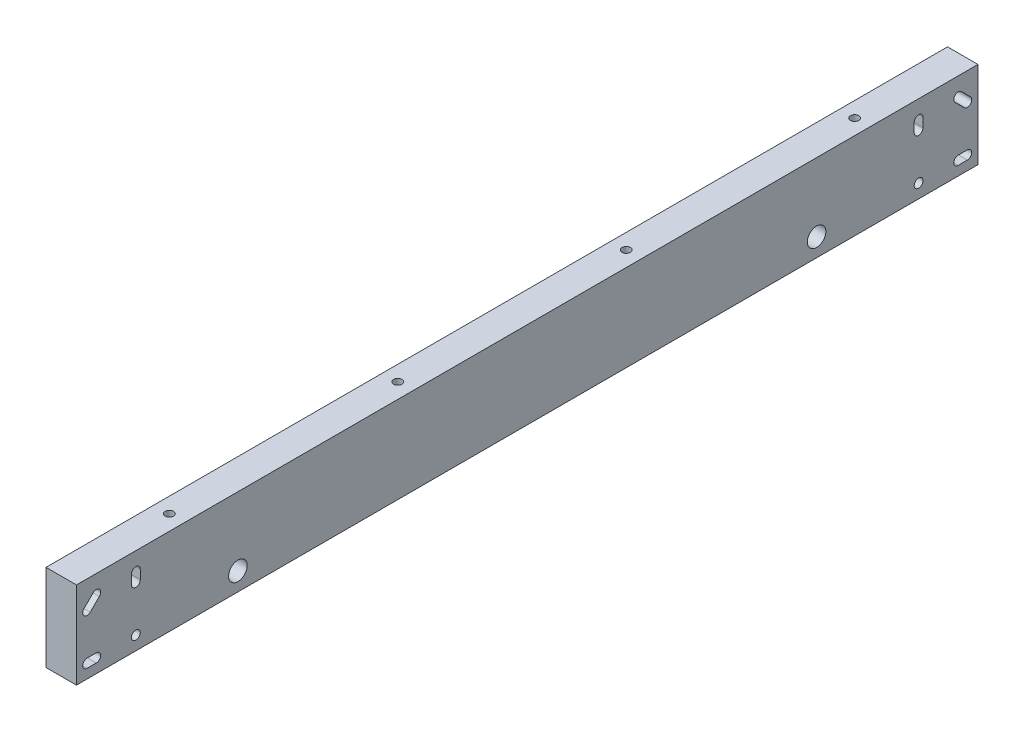
from build123d import *

# Parameters (mm, degrees)
CUT_EXTRUDE1_START       = 5
CUT_EXTRUDE1_OUTLINE_W   = 57
CUT_EXTRUDE1_OUTLINE_H   = 592
CUT_EXTRUDE1_DEPTH       = 5
CUT_EXTRUDE1_START_2     = -10
CUT_EXTRUDE1_2_OUTLINE_W = 57
CUT_EXTRUDE1_2_OUTLINE_H = 592
CUT_EXTRUDE1_2_DEPTH     = 4.9999999
CUT_EXTRUDE1_START_3     = -4.6
CUT_EXTRUDE1_3_DEPTH     = 14.6
CUT_EXTRUDE1_START_4     = -296
CUT_EXTRUDE1_4_OUTLINE_W = 10.0000001
CUT_EXTRUDE1_4_OUTLINE_H = 57
CUT_EXTRUDE1_4_DEPTH     = 592
CUT_EXTRUDE1_START_5     = -73
CUT_EXTRUDE1_5_OUTLINE_R = 5
CUT_EXTRUDE1_5_DEPTH     = 23
CUT_EXTRUDE1_START_6     = -50
CUT_EXTRUDE1_6_OUTLINE_R = 2.75
CUT_EXTRUDE1_6_DEPTH     = 36
CUT_EXTRUDE1_START_7     = -5.0000001
CUT_EXTRUDE1_7_DEPTH     = 10.0000001
CUT_EXTRUDE1_8_DEPTH     = 0.4000001
BOSS_EXTRUDE1_START      = -5.4
BOSS_EXTRUDE1_DEPTH      = 14.6
BOSS_EXTRUDE2_START      = 5.4
BOSS_EXTRUDE2_DEPTH      = 5.4
CUT_EXTRUDE2_DEPTH       = 5.4
CUT_EXTRUDE3_DEPTH       = 306.286750449
SKETCH6_R                = 6.1
CUT_EXTRUDE4_DEPTH       = 306.286750449


with BuildPart() as part:
    # Cut-Extrude1: read off the stored shape, not the designer's step
    # Cut-Extrude1 outline → Cut-Extrude1 (new body)
    with BuildSketch(Plane.YZ.offset(CUT_EXTRUDE1_START)):
        with Locations((-43.5, 0)):
            Rectangle(CUT_EXTRUDE1_OUTLINE_W, CUT_EXTRUDE1_OUTLINE_H)
        with BuildLine():
            Line((-61.5, -285.9), (-64.5, -285.9))
            ThreePointArc((-64.5, -285.9), (-67.4, -283), (-64.5, -280.1))
            Line((-64.5, -280.1), (-61.5, -280.1))
            ThreePointArc((-61.5, -280.1), (-58.6, -283), (-61.5, -285.9))
        make_face(mode=Mode.SUBTRACT)
        with BuildLine():
            Line((-61.5, -259.9), (-64.5, -259.9))
            ThreePointArc((-64.5, -259.9), (-67.4, -257), (-64.5, -254.1))
            Line((-64.5, -254.1), (-61.5, -254.1))
            ThreePointArc((-61.5, -254.1), (-58.6, -257), (-61.5, -259.9))
        make_face(mode=Mode.SUBTRACT)
        with BuildLine():
            Line((-28.5, -280.1), (-25.5, -280.1))
            ThreePointArc((-25.5, -280.1), (-22.6, -283), (-25.5, -285.9))
            Line((-25.5, -285.9), (-28.5, -285.9))
            ThreePointArc((-28.5, -285.9), (-31.4, -283), (-28.5, -280.1))
        make_face(mode=Mode.SUBTRACT)
        with BuildLine():
            Line((-28.5, -254.1), (-25.5, -254.1))
            ThreePointArc((-25.5, -254.1), (-22.6, -257), (-25.5, -259.9))
            Line((-25.5, -259.9), (-28.5, -259.9))
            ThreePointArc((-28.5, -259.9), (-31.4, -257), (-28.5, -254.1))
        make_face(mode=Mode.SUBTRACT)
        with BuildLine():
            Line((-61.5, 254.1), (-64.5, 254.1))
            ThreePointArc((-64.5, 254.1), (-67.4, 257), (-64.5, 259.9))
            Line((-64.5, 259.9), (-61.5, 259.9))
            ThreePointArc((-61.5, 259.9), (-58.6, 257), (-61.5, 254.1))
        make_face(mode=Mode.SUBTRACT)
        with BuildLine():
            Line((-61.5, 280.1), (-64.5, 280.1))
            ThreePointArc((-64.5, 280.1), (-67.4, 283), (-64.5, 285.9))
            Line((-64.5, 285.9), (-61.5, 285.9))
            ThreePointArc((-61.5, 285.9), (-58.6, 283), (-61.5, 280.1))
        make_face(mode=Mode.SUBTRACT)
        with BuildLine():
            Line((-28.5, 259.9), (-25.5, 259.9))
            ThreePointArc((-25.5, 259.9), (-22.6, 257), (-25.5, 254.1))
            Line((-25.5, 254.1), (-28.5, 254.1))
            ThreePointArc((-28.5, 254.1), (-31.4, 257), (-28.5, 259.9))
        make_face(mode=Mode.SUBTRACT)
        with BuildLine():
            Line((-28.5, 285.9), (-25.5, 285.9))
            ThreePointArc((-25.5, 285.9), (-22.6, 283), (-25.5, 280.1))
            Line((-25.5, 280.1), (-28.5, 280.1))
            ThreePointArc((-28.5, 280.1), (-31.4, 283), (-28.5, 285.9))
        make_face(mode=Mode.SUBTRACT)
    extrude(amount=CUT_EXTRUDE1_DEPTH)

    # Cut-Extrude1 3 outline → Cut-Extrude1 3 (add)
    # profile 1 of 8: a face of its own
    with BuildSketch(Plane.YZ.offset(CUT_EXTRUDE1_START_3)):
        with BuildLine():
            Line((-25.5, 288), (-28.5, 288))
            ThreePointArc((-28.5, 288), (-33.5, 283), (-28.5, 278))
            Line((-28.5, 278), (-25.5, 278))
            ThreePointArc((-25.5, 278), (-20.5, 283), (-25.5, 288))
        make_face()
        with BuildLine():
            Line((-28.5, 285.9), (-25.5, 285.9))
            ThreePointArc((-25.5, 285.9), (-22.6, 283), (-25.5, 280.1))
            Line((-25.5, 280.1), (-28.5, 280.1))
            ThreePointArc((-28.5, 280.1), (-31.4, 283), (-28.5, 285.9))
        make_face(mode=Mode.SUBTRACT)
    # profile 2 of 8: a face of its own
    with BuildSketch(Plane.YZ.offset(CUT_EXTRUDE1_START_3)):
        with BuildLine():
            Line((-25.5, 262), (-28.5, 262))
            ThreePointArc((-28.5, 262), (-33.5, 257), (-28.5, 252))
            Line((-28.5, 252), (-25.5, 252))
            ThreePointArc((-25.5, 252), (-20.5, 257), (-25.5, 262))
        make_face()
        with BuildLine():
            Line((-28.5, 259.9), (-25.5, 259.9))
            ThreePointArc((-25.5, 259.9), (-22.6, 257), (-25.5, 254.1))
            Line((-25.5, 254.1), (-28.5, 254.1))
            ThreePointArc((-28.5, 254.1), (-31.4, 257), (-28.5, 259.9))
        make_face(mode=Mode.SUBTRACT)
    # profile 3 of 8: a face of its own
    with BuildSketch(Plane.YZ.offset(CUT_EXTRUDE1_START_3)):
        with BuildLine():
            Line((-64.5, 252), (-61.5, 252))
            ThreePointArc((-61.5, 252), (-56.5, 257), (-61.5, 262))
            Line((-61.5, 262), (-64.5, 262))
            ThreePointArc((-64.5, 262), (-69.5, 257), (-64.5, 252))
        make_face()
        with BuildLine():
            Line((-61.5, 254.1), (-64.5, 254.1))
            ThreePointArc((-64.5, 254.1), (-67.4, 257), (-64.5, 259.9))
            Line((-64.5, 259.9), (-61.5, 259.9))
            ThreePointArc((-61.5, 259.9), (-58.6, 257), (-61.5, 254.1))
        make_face(mode=Mode.SUBTRACT)
    # profile 4 of 8: a face of its own
    with BuildSketch(Plane.YZ.offset(CUT_EXTRUDE1_START_3)):
        with BuildLine():
            Line((-64.5, 278), (-61.5, 278))
            ThreePointArc((-61.5, 278), (-56.5, 283), (-61.5, 288))
            Line((-61.5, 288), (-64.5, 288))
            ThreePointArc((-64.5, 288), (-69.5, 283), (-64.5, 278))
        make_face()
        with BuildLine():
            Line((-61.5, 280.1), (-64.5, 280.1))
            ThreePointArc((-64.5, 280.1), (-67.4, 283), (-64.5, 285.9))
            Line((-64.5, 285.9), (-61.5, 285.9))
            ThreePointArc((-61.5, 285.9), (-58.6, 283), (-61.5, 280.1))
        make_face(mode=Mode.SUBTRACT)
    # profile 5 of 8: a face of its own
    with BuildSketch(Plane.YZ.offset(CUT_EXTRUDE1_START_3)):
        with BuildLine():
            Line((-64.5, -288), (-61.5, -288))
            ThreePointArc((-61.5, -288), (-56.5, -283), (-61.5, -278))
            Line((-61.5, -278), (-64.5, -278))
            ThreePointArc((-64.5, -278), (-69.5, -283), (-64.5, -288))
        make_face()
        with BuildLine():
            Line((-61.5, -285.9), (-64.5, -285.9))
            ThreePointArc((-64.5, -285.9), (-67.4, -283), (-64.5, -280.1))
            Line((-64.5, -280.1), (-61.5, -280.1))
            ThreePointArc((-61.5, -280.1), (-58.6, -283), (-61.5, -285.9))
        make_face(mode=Mode.SUBTRACT)
    # profile 6 of 8: a face of its own
    with BuildSketch(Plane.YZ.offset(CUT_EXTRUDE1_START_3)):
        with BuildLine():
            Line((-64.5, -262), (-61.5, -262))
            ThreePointArc((-61.5, -262), (-56.5, -257), (-61.5, -252))
            Line((-61.5, -252), (-64.5, -252))
            ThreePointArc((-64.5, -252), (-69.5, -257), (-64.5, -262))
        make_face()
        with BuildLine():
            Line((-61.5, -259.9), (-64.5, -259.9))
            ThreePointArc((-64.5, -259.9), (-67.4, -257), (-64.5, -254.1))
            Line((-64.5, -254.1), (-61.5, -254.1))
            ThreePointArc((-61.5, -254.1), (-58.6, -257), (-61.5, -259.9))
        make_face(mode=Mode.SUBTRACT)
    # profile 7 of 8: a face of its own
    with BuildSketch(Plane.YZ.offset(CUT_EXTRUDE1_START_3)):
        with BuildLine():
            Line((-25.5, -252), (-28.5, -252))
            ThreePointArc((-28.5, -252), (-33.5, -257), (-28.5, -262))
            Line((-28.5, -262), (-25.5, -262))
            ThreePointArc((-25.5, -262), (-20.5, -257), (-25.5, -252))
        make_face()
        with BuildLine():
            Line((-28.5, -254.1), (-25.5, -254.1))
            ThreePointArc((-25.5, -254.1), (-22.6, -257), (-25.5, -259.9))
            Line((-25.5, -259.9), (-28.5, -259.9))
            ThreePointArc((-28.5, -259.9), (-31.4, -257), (-28.5, -254.1))
        make_face(mode=Mode.SUBTRACT)
    # profile 8 of 8: a face of its own
    with BuildSketch(Plane.YZ.offset(CUT_EXTRUDE1_START_3)):
        with BuildLine():
            Line((-25.5, -278), (-28.5, -278))
            ThreePointArc((-28.5, -278), (-33.5, -283), (-28.5, -288))
            Line((-28.5, -288), (-25.5, -288))
            ThreePointArc((-25.5, -288), (-20.5, -283), (-25.5, -278))
        make_face()
        with BuildLine():
            Line((-28.5, -280.1), (-25.5, -280.1))
            ThreePointArc((-25.5, -280.1), (-22.6, -283), (-25.5, -285.9))
            Line((-25.5, -285.9), (-28.5, -285.9))
            ThreePointArc((-28.5, -285.9), (-31.4, -283), (-28.5, -280.1))
        make_face(mode=Mode.SUBTRACT)
    extrude(amount=CUT_EXTRUDE1_3_DEPTH)



with BuildPart() as body_2:
    # Cut-Extrude1 2 outline → Cut-Extrude1 2 (new body)
    with BuildSketch(Plane.YZ.offset(CUT_EXTRUDE1_START_2)):
        with Locations((-43.5, 0)):
            Rectangle(CUT_EXTRUDE1_2_OUTLINE_W, CUT_EXTRUDE1_2_OUTLINE_H)
        with BuildLine():
            ThreePointArc((-61.5, -278), (-56.5, -283), (-61.5, -288))
            Line((-61.5, -288), (-64.5, -288))
            ThreePointArc((-64.5, -288), (-69.5, -283), (-64.5, -278))
            Line((-64.5, -278), (-61.5, -278))
        make_face(mode=Mode.SUBTRACT)
        with BuildLine():
            ThreePointArc((-61.5, -252), (-56.5, -257), (-61.5, -262))
            Line((-61.5, -262), (-64.5, -262))
            ThreePointArc((-64.5, -262), (-69.5, -257), (-64.5, -252))
            Line((-64.5, -252), (-61.5, -252))
        make_face(mode=Mode.SUBTRACT)
        with BuildLine():
            ThreePointArc((-28.5, -288), (-33.5, -283), (-28.5, -278))
            Line((-28.5, -278), (-25.5, -278))
            ThreePointArc((-25.5, -278), (-20.5, -283), (-25.5, -288))
            Line((-25.5, -288), (-28.5, -288))
        make_face(mode=Mode.SUBTRACT)
        with BuildLine():
            ThreePointArc((-28.5, -262), (-33.5, -257), (-28.5, -252))
            Line((-28.5, -252), (-25.5, -252))
            ThreePointArc((-25.5, -252), (-20.5, -257), (-25.5, -262))
            Line((-25.5, -262), (-28.5, -262))
        make_face(mode=Mode.SUBTRACT)
        with BuildLine():
            ThreePointArc((-61.5, 262), (-56.5, 257), (-61.5, 252))
            Line((-61.5, 252), (-64.5, 252))
            ThreePointArc((-64.5, 252), (-69.5, 257), (-64.5, 262))
            Line((-64.5, 262), (-61.5, 262))
        make_face(mode=Mode.SUBTRACT)
        with BuildLine():
            ThreePointArc((-61.5, 288), (-56.5, 283), (-61.5, 278))
            Line((-61.5, 278), (-64.5, 278))
            ThreePointArc((-64.5, 278), (-69.5, 283), (-64.5, 288))
            Line((-64.5, 288), (-61.5, 288))
        make_face(mode=Mode.SUBTRACT)
        with BuildLine():
            ThreePointArc((-28.5, 252), (-33.5, 257), (-28.5, 262))
            Line((-28.5, 262), (-25.5, 262))
            ThreePointArc((-25.5, 262), (-20.5, 257), (-25.5, 252))
            Line((-25.5, 252), (-28.5, 252))
        make_face(mode=Mode.SUBTRACT)
        with BuildLine():
            ThreePointArc((-28.5, 278), (-33.5, 283), (-28.5, 288))
            Line((-28.5, 288), (-25.5, 288))
            ThreePointArc((-25.5, 288), (-20.5, 283), (-25.5, 278))
            Line((-25.5, 278), (-28.5, 278))
        make_face(mode=Mode.SUBTRACT)
    extrude(amount=CUT_EXTRUDE1_2_DEPTH)


with BuildPart() as part_1:
    add(part.part)

    add(body_2.part)  # Cut-Extrude1 4 merges body 2
    # Cut-Extrude1 4 outline → Cut-Extrude1 4 (add)
    with BuildSketch(Plane.XY.offset(CUT_EXTRUDE1_START_4)):
        with Locations((-5e-08, -43.5)):
            Rectangle(CUT_EXTRUDE1_4_OUTLINE_W, CUT_EXTRUDE1_4_OUTLINE_H)
    extrude(amount=CUT_EXTRUDE1_4_DEPTH)

    # Cut-Extrude1 5 outline → Cut-Extrude1 5 (cut)
    with BuildSketch(Plane(origin=(0, 0, 0), x_dir=(1, 0, 0), z_dir=(0, 1, 0)).offset(CUT_EXTRUDE1_START_5)):
        with Locations((0, -225)):
            Circle(CUT_EXTRUDE1_5_OUTLINE_R)
        with Locations((0, -75)):
            Circle(CUT_EXTRUDE1_5_OUTLINE_R)
        with Locations((0, 75)):
            Circle(CUT_EXTRUDE1_5_OUTLINE_R)
        with Locations((0, 225)):
            Circle(CUT_EXTRUDE1_5_OUTLINE_R)
    extrude(amount=CUT_EXTRUDE1_5_DEPTH, mode=Mode.SUBTRACT)

    # Cut-Extrude1 6 outline → Cut-Extrude1 6 (cut)
    with BuildSketch(Plane(origin=(0, 0, 0), x_dir=(1, 0, 0), z_dir=(0, 1, 0)).offset(CUT_EXTRUDE1_START_6)):
        with Locations((0, -225)):
            Circle(CUT_EXTRUDE1_6_OUTLINE_R)
        with Locations((0, -75)):
            Circle(CUT_EXTRUDE1_6_OUTLINE_R)
        with Locations((0, 75)):
            Circle(CUT_EXTRUDE1_6_OUTLINE_R)
        with Locations((0, 225)):
            Circle(CUT_EXTRUDE1_6_OUTLINE_R)
    extrude(amount=CUT_EXTRUDE1_6_DEPTH, mode=Mode.SUBTRACT)

    # Cut-Extrude1 7 outline → Cut-Extrude1 7 (cut)
    with BuildSketch(Plane.YZ.offset(CUT_EXTRUDE1_START_7)):
        with BuildLine():
            ThreePointArc((-25.5, 280.1), (-22.6, 283), (-25.5, 285.9))
            Line((-25.5, 285.9), (-28.5, 285.9))
            ThreePointArc((-28.5, 285.9), (-31.4, 283), (-28.5, 280.1))
            Line((-28.5, 280.1), (-25.5, 280.1))
        make_face()
        with BuildLine():
            ThreePointArc((-61.5, 280.1), (-58.6, 283), (-61.5, 285.9))
            Line((-61.5, 285.9), (-64.5, 285.9))
            ThreePointArc((-64.5, 285.9), (-67.4, 283), (-64.5, 280.1))
            Line((-64.5, 280.1), (-61.5, 280.1))
        make_face()
        with BuildLine():
            ThreePointArc((-25.5, 254.1), (-22.6, 257), (-25.5, 259.9))
            Line((-25.5, 259.9), (-28.5, 259.9))
            ThreePointArc((-28.5, 259.9), (-31.4, 257), (-28.5, 254.1))
            Line((-28.5, 254.1), (-25.5, 254.1))
        make_face()
        with BuildLine():
            ThreePointArc((-61.5, 254.1), (-58.6, 257), (-61.5, 259.9))
            Line((-61.5, 259.9), (-64.5, 259.9))
            ThreePointArc((-64.5, 259.9), (-67.4, 257), (-64.5, 254.1))
            Line((-64.5, 254.1), (-61.5, 254.1))
        make_face()
        with BuildLine():
            ThreePointArc((-64.5, -280.1), (-67.4, -283), (-64.5, -285.9))
            Line((-64.5, -285.9), (-61.5, -285.9))
            ThreePointArc((-61.5, -285.9), (-58.6, -283), (-61.5, -280.1))
            Line((-61.5, -280.1), (-64.5, -280.1))
        make_face()
        with BuildLine():
            ThreePointArc((-28.5, -280.1), (-31.4, -283), (-28.5, -285.9))
            Line((-28.5, -285.9), (-25.5, -285.9))
            ThreePointArc((-25.5, -285.9), (-22.6, -283), (-25.5, -280.1))
            Line((-25.5, -280.1), (-28.5, -280.1))
        make_face()
        with BuildLine():
            ThreePointArc((-64.5, -254.1), (-67.4, -257), (-64.5, -259.9))
            Line((-64.5, -259.9), (-61.5, -259.9))
            ThreePointArc((-61.5, -259.9), (-58.6, -257), (-61.5, -254.1))
            Line((-61.5, -254.1), (-64.5, -254.1))
        make_face()
        with BuildLine():
            ThreePointArc((-28.5, -254.1), (-31.4, -257), (-28.5, -259.9))
            Line((-28.5, -259.9), (-25.5, -259.9))
            ThreePointArc((-25.5, -259.9), (-22.6, -257), (-25.5, -254.1))
            Line((-25.5, -254.1), (-28.5, -254.1))
        make_face()
    extrude(amount=CUT_EXTRUDE1_7_DEPTH, mode=Mode.SUBTRACT)

    # Cut-Extrude1 8 outline → Cut-Extrude1 8 (cut)
    # profile 1 of 8: a face of its own
    with BuildSketch(Plane.YZ.offset(CUT_EXTRUDE1_START_7)):
        with BuildLine():
            Line((-25.5, 288), (-28.5, 288))
            ThreePointArc((-28.5, 288), (-33.5, 283), (-28.5, 278))
            Line((-28.5, 278), (-25.5, 278))
            ThreePointArc((-25.5, 278), (-20.5, 283), (-25.5, 288))
        make_face()
        with BuildLine():
            Line((-28.5, 285.9), (-25.5, 285.9))
            ThreePointArc((-25.5, 285.9), (-22.6, 283), (-25.5, 280.1))
            Line((-25.5, 280.1), (-28.5, 280.1))
            ThreePointArc((-28.5, 280.1), (-31.4, 283), (-28.5, 285.9))
        make_face(mode=Mode.SUBTRACT)
    # profile 2 of 8: a face of its own
    with BuildSketch(Plane.YZ.offset(CUT_EXTRUDE1_START_7)):
        with BuildLine():
            Line((-61.5, 288), (-64.5, 288))
            ThreePointArc((-64.5, 288), (-69.5, 283), (-64.5, 278))
            Line((-64.5, 278), (-61.5, 278))
            ThreePointArc((-61.5, 278), (-56.5, 283), (-61.5, 288))
        make_face()
        with BuildLine():
            Line((-64.5, 285.9), (-61.5, 285.9))
            ThreePointArc((-61.5, 285.9), (-58.6, 283), (-61.5, 280.1))
            Line((-61.5, 280.1), (-64.5, 280.1))
            ThreePointArc((-64.5, 280.1), (-67.4, 283), (-64.5, 285.9))
        make_face(mode=Mode.SUBTRACT)
    # profile 3 of 8: a face of its own
    with BuildSketch(Plane.YZ.offset(CUT_EXTRUDE1_START_7)):
        with BuildLine():
            Line((-25.5, 262), (-28.5, 262))
            ThreePointArc((-28.5, 262), (-33.5, 257), (-28.5, 252))
            Line((-28.5, 252), (-25.5, 252))
            ThreePointArc((-25.5, 252), (-20.5, 257), (-25.5, 262))
        make_face()
        with BuildLine():
            Line((-28.5, 259.9), (-25.5, 259.9))
            ThreePointArc((-25.5, 259.9), (-22.6, 257), (-25.5, 254.1))
            Line((-25.5, 254.1), (-28.5, 254.1))
            ThreePointArc((-28.5, 254.1), (-31.4, 257), (-28.5, 259.9))
        make_face(mode=Mode.SUBTRACT)
    # profile 4 of 8: a face of its own
    with BuildSketch(Plane.YZ.offset(CUT_EXTRUDE1_START_7)):
        with BuildLine():
            Line((-61.5, 262), (-64.5, 262))
            ThreePointArc((-64.5, 262), (-69.5, 257), (-64.5, 252))
            Line((-64.5, 252), (-61.5, 252))
            ThreePointArc((-61.5, 252), (-56.5, 257), (-61.5, 262))
        make_face()
        with BuildLine():
            Line((-64.5, 259.9), (-61.5, 259.9))
            ThreePointArc((-61.5, 259.9), (-58.6, 257), (-61.5, 254.1))
            Line((-61.5, 254.1), (-64.5, 254.1))
            ThreePointArc((-64.5, 254.1), (-67.4, 257), (-64.5, 259.9))
        make_face(mode=Mode.SUBTRACT)
    # profile 5 of 8: a face of its own
    with BuildSketch(Plane.YZ.offset(CUT_EXTRUDE1_START_7)):
        with BuildLine():
            Line((-64.5, -288), (-61.5, -288))
            ThreePointArc((-61.5, -288), (-56.5, -283), (-61.5, -278))
            Line((-61.5, -278), (-64.5, -278))
            ThreePointArc((-64.5, -278), (-69.5, -283), (-64.5, -288))
        make_face()
        with BuildLine():
            Line((-61.5, -285.9), (-64.5, -285.9))
            ThreePointArc((-64.5, -285.9), (-67.4, -283), (-64.5, -280.1))
            Line((-64.5, -280.1), (-61.5, -280.1))
            ThreePointArc((-61.5, -280.1), (-58.6, -283), (-61.5, -285.9))
        make_face(mode=Mode.SUBTRACT)
    # profile 6 of 8: a face of its own
    with BuildSketch(Plane.YZ.offset(CUT_EXTRUDE1_START_7)):
        with BuildLine():
            Line((-28.5, -288), (-25.5, -288))
            ThreePointArc((-25.5, -288), (-20.5, -283), (-25.5, -278))
            Line((-25.5, -278), (-28.5, -278))
            ThreePointArc((-28.5, -278), (-33.5, -283), (-28.5, -288))
        make_face()
        with BuildLine():
            Line((-25.5, -285.9), (-28.5, -285.9))
            ThreePointArc((-28.5, -285.9), (-31.4, -283), (-28.5, -280.1))
            Line((-28.5, -280.1), (-25.5, -280.1))
            ThreePointArc((-25.5, -280.1), (-22.6, -283), (-25.5, -285.9))
        make_face(mode=Mode.SUBTRACT)
    # profile 7 of 8: a face of its own
    with BuildSketch(Plane.YZ.offset(CUT_EXTRUDE1_START_7)):
        with BuildLine():
            Line((-64.5, -262), (-61.5, -262))
            ThreePointArc((-61.5, -262), (-56.5, -257), (-61.5, -252))
            Line((-61.5, -252), (-64.5, -252))
            ThreePointArc((-64.5, -252), (-69.5, -257), (-64.5, -262))
        make_face()
        with BuildLine():
            Line((-61.5, -259.9), (-64.5, -259.9))
            ThreePointArc((-64.5, -259.9), (-67.4, -257), (-64.5, -254.1))
            Line((-64.5, -254.1), (-61.5, -254.1))
            ThreePointArc((-61.5, -254.1), (-58.6, -257), (-61.5, -259.9))
        make_face(mode=Mode.SUBTRACT)
    # profile 8 of 8: a face of its own
    with BuildSketch(Plane.YZ.offset(CUT_EXTRUDE1_START_7)):
        with BuildLine():
            Line((-28.5, -262), (-25.5, -262))
            ThreePointArc((-25.5, -262), (-20.5, -257), (-25.5, -252))
            Line((-25.5, -252), (-28.5, -252))
            ThreePointArc((-28.5, -252), (-33.5, -257), (-28.5, -262))
        make_face()
        with BuildLine():
            Line((-25.5, -259.9), (-28.5, -259.9))
            ThreePointArc((-28.5, -259.9), (-31.4, -257), (-28.5, -254.1))
            Line((-28.5, -254.1), (-25.5, -254.1))
            ThreePointArc((-25.5, -254.1), (-22.6, -257), (-25.5, -259.9))
        make_face(mode=Mode.SUBTRACT)
    extrude(amount=CUT_EXTRUDE1_8_DEPTH, mode=Mode.SUBTRACT)

    # Sketch2 → Boss-Extrude1 (add)
    with BuildSketch(Plane.ZY.offset(10).offset(BOSS_EXTRUDE1_START)):
        with BuildLine():
            Line((259.9, -27), (259.9, -25.5))
            ThreePointArc((259.9, -25.5), (257, -22.6), (254.1, -25.5))
            Line((254.1, -25.5), (254.1, -27))
            ThreePointArc((254.1, -27), (257, -24.1), (259.9, -27))
        make_face()
        with BuildLine():
            Line((259.9, -28.5), (259.9, -27))
            ThreePointArc((259.9, -27), (257, -29.9), (254.1, -27))
            Line((254.1, -27), (254.1, -28.5))
            ThreePointArc((254.1, -28.5), (257, -31.4), (259.9, -28.5))
        make_face()
        with BuildLine():
            Line((285.9, -27), (285.9, -25.5))
            ThreePointArc((285.9, -25.5), (283, -22.6), (280.1, -25.5))
            Line((280.1, -25.5), (280.1, -27))
            ThreePointArc((280.1, -27), (283, -24.1), (285.9, -27))
        make_face()
        with BuildLine():
            Line((285.9, -28.5), (285.9, -27))
            ThreePointArc((285.9, -27), (283, -29.9), (280.1, -27))
            Line((280.1, -27), (280.1, -28.5))
            ThreePointArc((280.1, -28.5), (283, -31.4), (285.9, -28.5))
        make_face()
        with BuildLine():
            Line((259.9, -63), (259.9, -61.5))
            ThreePointArc((259.9, -61.5), (257, -58.6), (254.1, -61.5))
            Line((254.1, -61.5), (254.1, -63))
            ThreePointArc((254.1, -63), (257, -60.1), (259.9, -63))
        make_face()
        with BuildLine():
            Line((259.9, -64.5), (259.9, -63))
            ThreePointArc((259.9, -63), (257, -65.9), (254.1, -63))
            Line((254.1, -63), (254.1, -64.5))
            ThreePointArc((254.1, -64.5), (257, -67.4), (259.9, -64.5))
        make_face()
        with BuildLine():
            Line((285.9, -63), (285.9, -61.5))
            ThreePointArc((285.9, -61.5), (283, -58.6), (280.1, -61.5))
            Line((280.1, -61.5), (280.1, -63))
            ThreePointArc((280.1, -63), (283, -60.1), (285.9, -63))
        make_face()
        with BuildLine():
            Line((285.9, -64.5), (285.9, -63))
            ThreePointArc((285.9, -63), (283, -65.9), (280.1, -63))
            Line((280.1, -63), (280.1, -64.5))
            ThreePointArc((280.1, -64.5), (283, -67.4), (285.9, -64.5))
        make_face()
    boss_extrude1 = extrude(amount=-BOSS_EXTRUDE1_DEPTH)

    # Sketch3 → Boss-Extrude2 (add)
    with BuildSketch(Plane.ZY.offset(4.6).offset(BOSS_EXTRUDE2_START)):
        with BuildLine():
            ThreePointArc((288, -25.5), (283, -20.5), (278, -25.5))
            Line((278, -25.5), (278, -27))
            ThreePointArc((278, -27), (283, -22), (288, -27))
            Line((288, -27), (288, -25.5))
        make_face()
        with BuildLine():
            ThreePointArc((262, -25.5), (257, -20.5), (252, -25.5))
            Line((252, -25.5), (252, -27))
            ThreePointArc((252, -27), (257, -22), (262, -27))
            Line((262, -27), (262, -25.5))
        make_face()
        with BuildLine():
            ThreePointArc((288, -61.5), (283, -56.5), (278, -61.5))
            Line((278, -61.5), (278, -63))
            ThreePointArc((278, -63), (283, -58), (288, -63))
            Line((288, -63), (288, -61.5))
        make_face()
        with BuildLine():
            ThreePointArc((262, -61.5), (257, -56.5), (252, -61.5))
            Line((252, -61.5), (252, -63))
            ThreePointArc((252, -63), (257, -58), (262, -63))
            Line((262, -63), (262, -61.5))
        make_face()
        with BuildLine():
            ThreePointArc((288, -27), (283, -32), (278, -27))
            Line((278, -27), (278, -28.5))
            ThreePointArc((278, -28.5), (283, -33.5), (288, -28.5))
            Line((288, -28.5), (288, -27))
        make_face()
        with BuildLine():
            ThreePointArc((262, -27), (257, -32), (252, -27))
            Line((252, -27), (252, -28.5))
            ThreePointArc((252, -28.5), (257, -33.5), (262, -28.5))
            Line((262, -28.5), (262, -27))
        make_face()
        with BuildLine():
            ThreePointArc((262, -63), (257, -68), (252, -63))
            Line((252, -63), (252, -64.5))
            ThreePointArc((252, -64.5), (257, -69.5), (262, -64.5))
            Line((262, -64.5), (262, -63))
        make_face()
        with BuildLine():
            ThreePointArc((288, -63), (283, -68), (278, -63))
            Line((278, -63), (278, -64.5))
            ThreePointArc((278, -64.5), (283, -69.5), (288, -64.5))
            Line((288, -64.5), (288, -63))
        make_face()
    boss_extrude2 = extrude(amount=-BOSS_EXTRUDE2_DEPTH)

    # Mirror1: Boss-Extrude1, Boss-Extrude2 across plane
    add(boss_extrude1.mirror(Plane.XY))
    add(boss_extrude2.mirror(Plane.XY))

    # Sketch4 → Cut-Extrude2 (cut)
    with BuildSketch(Plane.ZY.offset(10)):
        with BuildLine():
            Line((-252, -27), (-252, -33))
            ThreePointArc((-252, -33), (-257, -38), (-262, -33))
            Line((-262, -33), (-262, -27))
            ThreePointArc((-262, -27), (-257, -22), (-252, -27))
        make_face()
        with BuildLine():
            Line((-279.464466094, -30.535533906), (-285.464466094, -36.535533906))
            ThreePointArc((-285.464466094, -36.535533906), (-292.535533906, -36.535533906), (-292.535533906, -29.464466094))
            Line((-292.535533906, -29.464466094), (-286.535533906, -23.464466094))
            ThreePointArc((-286.535533906, -23.464466094), (-279.464466094, -23.464466094), (-279.464466094, -30.535533906))
        make_face()
        with BuildLine():
            Line((-283, -68), (-289, -68))
            ThreePointArc((-289, -68), (-294, -63), (-289, -58))
            Line((-289, -58), (-283, -58))
            ThreePointArc((-283, -58), (-278, -63), (-283, -68))
        make_face()
    cut_extrude2 = extrude(amount=-CUT_EXTRUDE2_DEPTH, mode=Mode.SUBTRACT)

    # Sketch5 → Cut-Extrude3 (cut, through all)
    with BuildSketch(Plane.ZY.offset(10)):
        with BuildLine():
            Line((-280.949390335, -29.050609665), (-286.949390335, -35.050609665))
            ThreePointArc((-286.949390335, -35.050609665), (-291.050609665, -35.050609665), (-291.050609665, -30.949390335))
            Line((-291.050609665, -30.949390335), (-285.050609665, -24.949390335))
            ThreePointArc((-285.050609665, -24.949390335), (-280.949390335, -24.949390335), (-280.949390335, -29.050609665))
        make_face()
        with BuildLine():
            Line((-254.1, -27), (-254.1, -33))
            ThreePointArc((-254.1, -33), (-257, -35.9), (-259.9, -33))
            Line((-259.9, -33), (-259.9, -27))
            ThreePointArc((-259.9, -27), (-257, -24.1), (-254.1, -27))
        make_face()
        with BuildLine():
            Line((-283, -65.9), (-289, -65.9))
            ThreePointArc((-289, -65.9), (-291.9, -63), (-289, -60.1))
            Line((-289, -60.1), (-283, -60.1))
            ThreePointArc((-283, -60.1), (-280.1, -63), (-283, -65.9))
        make_face()
    cut_extrude3 = extrude(amount=-CUT_EXTRUDE3_DEPTH, mode=Mode.SUBTRACT)

    # Mirror2: Cut-Extrude2, Cut-Extrude3 across plane
    add(cut_extrude2.mirror(Plane.XY), mode=Mode.SUBTRACT)
    add(cut_extrude3.mirror(Plane.XY), mode=Mode.SUBTRACT)

    # Sketch6 → Cut-Extrude4 (cut, through all)
    with BuildSketch(Plane(origin=(10, 0, 0), x_dir=(0, 0, -1), z_dir=(1, 0, 0))):
        with Locations(Location((-190, -60, 0), (0, 0, 90))):
            Circle(SKETCH6_R)
        with Locations(Location((190, -60, 0), (0, 0, 90))):
            Circle(SKETCH6_R)
    extrude(amount=-CUT_EXTRUDE4_DEPTH, mode=Mode.SUBTRACT)


solid = part_1.part
